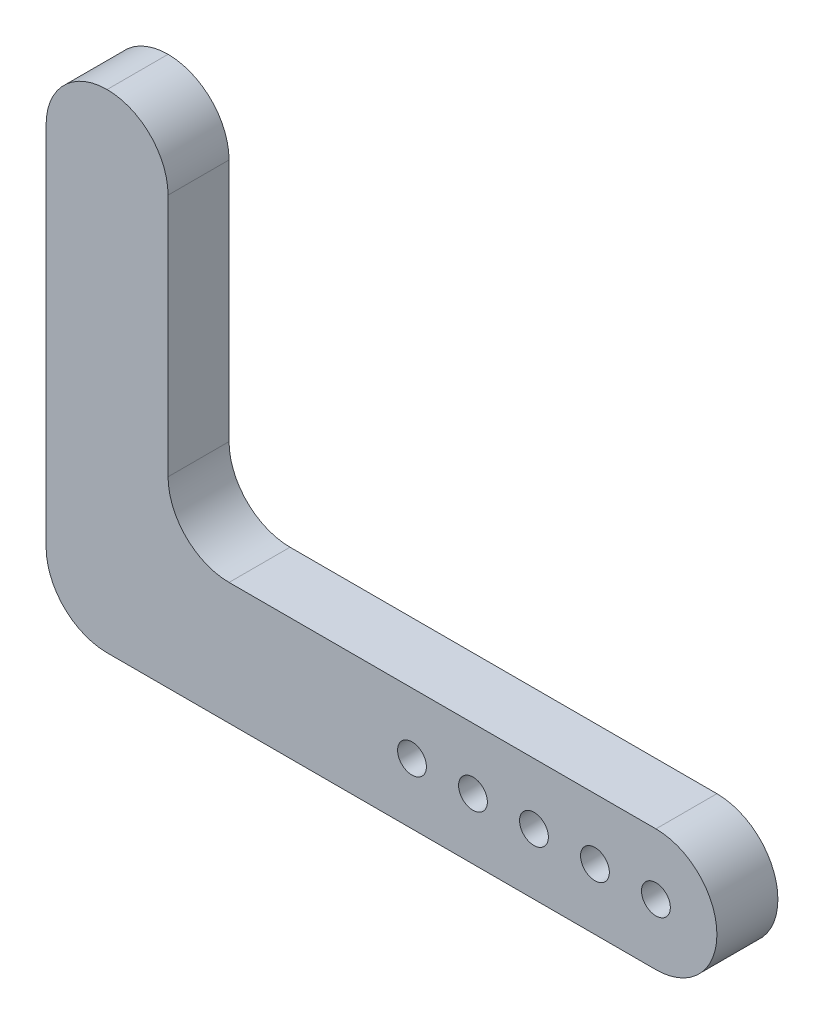
from build123d import *

# Parameters (mm, degrees)
SKETCH1_R           = 1.5
BOSS_EXTRUDE1_DEPTH = 6.35
FILLET1_R           = 6.35
SKETCH2_R           = 1.5
CUT_EXTRUDE1_DEPTH  = 78.771299333


with BuildPart() as part:
    # Sketch1 → Boss-Extrude1 (new body)
    with BuildSketch(Plane.XY):
        with BuildLine():
            Line((0, 6.35), (-50.8, 6.35))
            Line((-50.8, 6.35), (-50.8, 44.45))
            Line((-50.8, 44.45), (-63.5, 44.45))
            Line((-63.5, 44.45), (-63.5, -6.35))
            Line((-63.5, -6.35), (0, -6.35))
            ThreePointArc((0, -6.35), (6.35, 0), (0, 6.35))
        make_face()
        Circle(SKETCH1_R, mode=Mode.SUBTRACT)
    extrude(amount=BOSS_EXTRUDE1_DEPTH)

    # Fillet1
    fillet1_edges = [part.edges().sort_by_distance(p)[0] for p in [
        (-63.5, -6.35, 3.175),
        (-50.8, 6.35, 3.175),
        (-63.5, 44.45, 3.175),
        (-50.8, 44.45, 3.175),
    ]]
    fillet(fillet1_edges, radius=FILLET1_R - 0.0001)  # a hair under: the kernel refuses the full size

    # Sketch2 → Cut-Extrude1 (cut, through all)
    with BuildSketch(Plane(origin=(0, 0, 0), x_dir=(-1, 0, 0), z_dir=(0, 0, -1))):
        with Locations((6.35, 0)):
            Circle(SKETCH2_R)
        with Locations((12.7, 0)):
            Circle(SKETCH2_R)
        with Locations((25.4, 0)):
            Circle(SKETCH2_R)
        with Locations((19.05, 0)):
            Circle(SKETCH2_R)
    extrude(amount=-CUT_EXTRUDE1_DEPTH, mode=Mode.SUBTRACT)


solid = part.part
